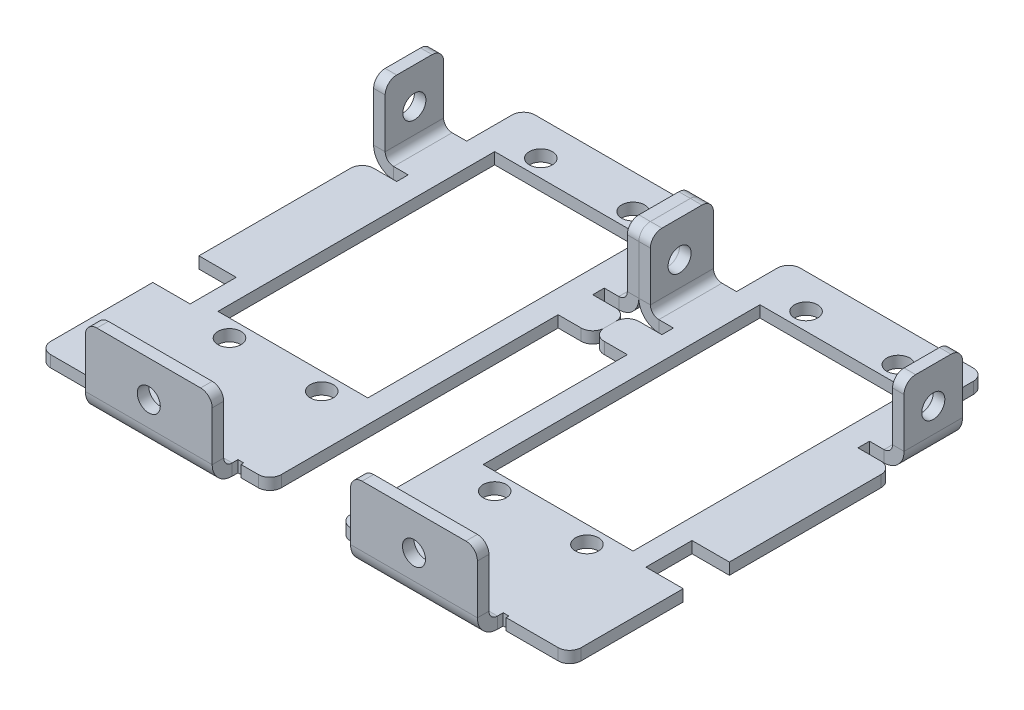
from build123d import *

# Parameters (mm, degrees)
SKETCH1_W                = 23
SKETCH1_H                = 50
BASE_FLANGE1_DEPTH       = 1
SKETCH8_W                = 13
SKETCH8_H                = 24
CUT_EXTRUDE2_DEPTH       = 56.045435778
SKETCH9_W                = 17
SKETCH9_H                = 9
SKETCH9_W_2              = 3
SKETCH9_H_2              = 1
SKETCH9_H_3              = 25
SKETCH9_W_3              = 6
SKETCH9_H_4              = 2
CUT_EXTRUDE3_DEPTH       = 56.045435778
EDGE_FLANGE1_START       = -36.069185562
EDGE_FLANGE1_DEPTH       = 5.069185562
EDGE_FLANGE1_START_2     = -36.470498128
EDGE_FLANGE1_2_DEPTH     = 0.401312566
EDGE_FLANGE1_START_3     = 6
EDGE_FLANGE1_3_DEPTH     = 11
EDGE_FLANGE1_4_DEPTH     = 5.470498128
EDGE_FLANGE1_START_4     = -2.2366
EDGE_FLANGE1_5_OUTLINE_W = 0.5
EDGE_FLANGE1_5_OUTLINE_H = 1
EDGE_FLANGE1_5_DEPTH     = 0.2366
EDGE_FLANGE1_6_DEPTH     = 11
FILLET1_R                = 1
SKETCH19_W               = 4.427639712
SKETCH19_H               = 4
CUT_EXTRUDE4_DEPTH       = 48.528938553
SKETCH20_R               = 1
CUT_EXTRUDE5_DEPTH       = 48.528938553
SKETCH21_R               = 1
CUT_EXTRUDE6_DEPTH       = 10
CUT_EXTRUDE7_DEPTH       = 47.914816423
CUT_EXTRUDE7_DEPTH_BACK  = 10
SKETCH22_R               = 1
FILLET2_R                = 1


# Read off the part's stored shape, not the designer's step: Edge-Flange1
# Sheet-metal steps are written as plain solids
with BuildPart() as part:
    # Sketch1 → Base-Flange1 (new body)
    with BuildSketch(Plane(origin=(0, 0, 0), x_dir=(1, 0, 0), z_dir=(0, 1, 0))):
        with Locations((11.5, 25)):
            Rectangle(SKETCH1_W, SKETCH1_H)
    extrude(amount=-BASE_FLANGE1_DEPTH)

    # Sketch8 → Cut-Extrude2 (cut, through all)
    with BuildSketch(Plane.XZ.offset(1)):
        with Locations((11.5, -24.5)):
            Rectangle(SKETCH8_W, SKETCH8_H)
    extrude(amount=-CUT_EXTRUDE2_DEPTH, mode=Mode.SUBTRACT)

    # Sketch9 → Cut-Extrude3 (cut, through all)
    with BuildSketch(Plane.XZ.offset(1)):
        with Locations((11.5, -45.5)):
            Rectangle(SKETCH9_W, SKETCH9_H)
        Polygon((0, -50), (3, -50), (3, -41), (3, -36.470498128), (0, -36.470498128), align=None)
        Polygon((23, -50), (23, -36.069185562), (20, -36.069185562), (20, -41), (20, -50), align=None)
        with Locations((21.5, -30.5)):
            Rectangle(SKETCH9_W_2, SKETCH9_H_2)
        with Locations((1.5, -30.5)):
            Rectangle(SKETCH9_W_2, SKETCH9_H_2)
        with Locations((1.5, -14.5)):
            Rectangle(SKETCH9_W_2, SKETCH9_H_3)
        with Locations((20, -1)):
            Rectangle(SKETCH9_W_3, SKETCH9_H_4)
        with Locations((4.5, -1)):
            Rectangle(SKETCH9_W_2, SKETCH9_H_4)
        with Locations((1.5, -1)):
            Rectangle(SKETCH9_W_2, SKETCH9_H_4)
    extrude(amount=-CUT_EXTRUDE3_DEPTH, mode=Mode.SUBTRACT)

    # Edge-Flange1 outline → Edge-Flange1 (add)
    with BuildSketch(Plane.XY.offset(EDGE_FLANGE1_START)):
        with BuildLine():
            Line((23, 0.7366), (23, 6))
            Line((23, 6), (22, 6))
            Line((22, 6), (22, 0.7366))
            ThreePointArc((22, 0.7366), (21.784254855, 0.215745145), (21.2634, 0))
            Line((21.2634, 0), (22.83604109, 0))
            ThreePointArc((22.83604109, 0), (22.958514757, 0.359286442), (23, 0.7366))
        make_face()
        with BuildLine():
            Line((0.16395891, 0), (1.7366, 0))
            ThreePointArc((1.7366, 0), (1.215745145, 0.215745145), (1, 0.7366))
            Line((1, 0.7366), (1, 6))
            Line((1, 6), (0, 6))
            Line((0, 6), (0, 0.7366))
            ThreePointArc((0, 0.7366), (0.041485243, 0.359286442), (0.16395891, 0))
        make_face()
    extrude(amount=EDGE_FLANGE1_DEPTH)

    # Edge-Flange1 2 outline → Edge-Flange1 2 (add)
    with BuildSketch(Plane.XY.offset(EDGE_FLANGE1_START_2)):
        with BuildLine():
            Line((0.16395891, 0), (1.7366, 0))
            ThreePointArc((1.7366, 0), (1.215745145, 0.215745145), (1, 0.7366))
            Line((1, 0.7366), (1, 6))
            Line((1, 6), (0, 6))
            Line((0, 6), (0, 0.7366))
            ThreePointArc((0, 0.7366), (0.041485243, 0.359286442), (0.16395891, 0))
        make_face()
    extrude(amount=EDGE_FLANGE1_2_DEPTH)

    # Edge-Flange1 3 outline → Edge-Flange1 3 (add)
    with BuildSketch(Plane.YZ.offset(EDGE_FLANGE1_START_3)):
        with BuildLine():
            Line((6, 0), (0.7366, 0))
            ThreePointArc((0.7366, 0), (0.359286442, -0.041485243), (0, -0.16395891))
            Line((0, -0.16395891), (0, -1.7366))
            ThreePointArc((0, -1.7366), (0.215745145, -1.215745145), (0.7366, -1))
            Line((0.7366, -1), (6, -1))
            Line((6, -1), (6, 0))
        make_face()
    extrude(amount=EDGE_FLANGE1_3_DEPTH)

    # Edge-Flange1 4 outline → Edge-Flange1 4 (cut)
    with BuildSketch(Plane.XY.offset(EDGE_FLANGE1_START_2)):
        with BuildLine():
            Line((23, 0), (22.83604109, 0))
            ThreePointArc((22.83604109, 0), (22.195226164, -0.728828115), (21.2634, -1))
            Line((21.2634, -1), (23, -1))
            Line((23, -1), (23, 0))
        make_face()
        with BuildLine():
            Line((0, -1), (1.7366, -1))
            ThreePointArc((1.7366, -1), (0.804773836, -0.728828115), (0.16395891, 0))
            Line((0.16395891, 0), (0, 0))
            Line((0, 0), (0, -1))
        make_face()
    extrude(amount=EDGE_FLANGE1_4_DEPTH, mode=Mode.SUBTRACT)

    # Edge-Flange1 5 outline → Edge-Flange1 5 (cut)
    with BuildSketch(Plane.XY.offset(EDGE_FLANGE1_START_4)):
        with Locations((17.25, -0.5)):
            Rectangle(EDGE_FLANGE1_5_OUTLINE_W, EDGE_FLANGE1_5_OUTLINE_H)
        with Locations((5.75, -0.5)):
            Rectangle(EDGE_FLANGE1_5_OUTLINE_W, EDGE_FLANGE1_5_OUTLINE_H)
    extrude(amount=EDGE_FLANGE1_5_DEPTH, mode=Mode.SUBTRACT)

    # Edge-Flange1 6 outline → Edge-Flange1 6 (cut)
    with BuildSketch(Plane.YZ.offset(EDGE_FLANGE1_START_3)):
        with BuildLine():
            ThreePointArc((-1, -1.7366), (-0.728828115, -0.804773836), (0, -0.16395891))
            Line((0, -0.16395891), (0, 0))
            Line((0, 0), (-1, 0))
            Line((-1, 0), (-1, -1.7366))
        make_face()
    extrude(amount=EDGE_FLANGE1_6_DEPTH, mode=Mode.SUBTRACT)

    # Fillet1
    fillet1_edges = [part.edges().sort_by_distance(p)[0] for p in [
        (3, -0.5, -2),
        (0, -0.5, -27),
        (6, 6, -0.5),
        (17, 6, -0.5),
        (0.5, 6, -36.470498128),
        (0.5, 6, -31),
        (22.5, 6, -31),
        (22.5, 6, -36.069185562),
        (23, -0.5, -30),
        (0, -0.5, -30),
        (23, -0.5, -2),
    ]]
    fillet(fillet1_edges, radius=FILLET1_R)

    # Sketch19 → Cut-Extrude4 (cut, through all)
    with BuildSketch(Plane.XZ.offset(1)):
        with Locations((21.977182604, -13.849068818)):
            Rectangle(SKETCH19_W, SKETCH19_H)
    extrude(amount=-CUT_EXTRUDE4_DEPTH, mode=Mode.SUBTRACT)

    # Sketch20 → Cut-Extrude5 (cut, through all)
    with BuildSketch(Plane.XZ.offset(1)):
        with Locations(Location((7.5, -11, 0), (0, 0, 270))):
            Circle(SKETCH20_R)
        with Locations(Location((15.5, -11, 0), (0, 0, 270))):
            Circle(SKETCH20_R)
        with Locations(Location((7.5, -38, 0), (0, 0, 270))):
            Circle(SKETCH20_R)
        with Locations(Location((15.5, -38, 0), (0, 0, 270))):
            Circle(SKETCH20_R)
    extrude(amount=-CUT_EXTRUDE5_DEPTH, mode=Mode.SUBTRACT)

    # Sketch21 → Cut-Extrude6 (cut)
    with BuildSketch(Plane(origin=(0, 0, -1), x_dir=(-1, 0, 0), z_dir=(0, 0, -1))):
        with Locations((-11.5, 2.8683)):
            Circle(SKETCH21_R)
    extrude(amount=-CUT_EXTRUDE6_DEPTH, mode=Mode.SUBTRACT)

    # Sketch22 → Cut-Extrude7 (cut, two sides: drawn at the far end of the back side and taken through both)
    with BuildSketch(Plane.ZY.offset(-22).offset(-CUT_EXTRUDE7_DEPTH_BACK)):
        with Locations(Location((-33.534592781, 2.8683, 0), (0, 0, 90))):
            Circle(SKETCH22_R)
    extrude(amount=CUT_EXTRUDE7_DEPTH + CUT_EXTRUDE7_DEPTH_BACK, mode=Mode.SUBTRACT)

    # Fillet2
    fillet2_edges = [part.edges().sort_by_distance(p)[0] for p in [
        (3, -0.5, -41),
        (20, -0.5, -41),
    ]]
    fillet(fillet2_edges, radius=FILLET2_R)


with BuildPart() as body_2:
    # Mirror1: mirrored copy
    add(part.part.mirror(Plane.ZY))


solid = Compound([part.part, body_2.part])
